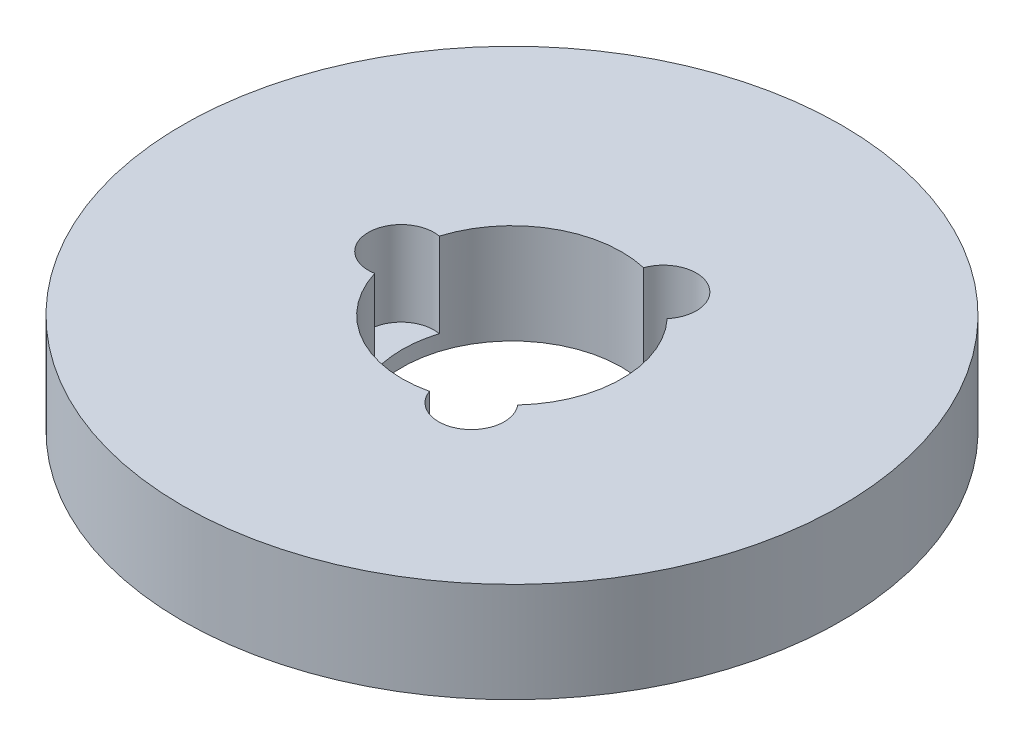
from build123d import *

# Parameters (mm, degrees)
SKETCH1_R           = 82.5
BOSS_EXTRUDE1_DEPTH = 25
SKETCH2_R           = 27.5
CUT_EXTRUDE1_DEPTH  = 120.320995638
SKETCH3_R           = 8.21948386
CUT_EXTRUDE2_DEPTH  = 21.153769994
CIRPATTERN1_COUNT   = 3


with BuildPart() as part:
    # Sketch1 → Boss-Extrude1 (new body)
    with BuildSketch(Plane(origin=(0, 0, 0), x_dir=(1, 0, 0), z_dir=(0, 1, 0))):
        Circle(SKETCH1_R)
    extrude(amount=BOSS_EXTRUDE1_DEPTH)

    # Sketch2 → Cut-Extrude1 (cut, through all)
    with BuildSketch(Plane(origin=(0, 0, 0), x_dir=(1, 0, 0), z_dir=(0, 1, 0))):
        Circle(SKETCH2_R)
    extrude(amount=CUT_EXTRUDE1_DEPTH, mode=Mode.SUBTRACT)

    # Sketch3 → Cut-Extrude2 (cut)
    with BuildSketch(Plane(origin=(0, 25, 0), x_dir=(1, 0, 0), z_dir=(0, 1, 0))):
        with Locations((-27.753009587, 0)):
            Circle(SKETCH3_R)
    cut_extrude2 = extrude(amount=-CUT_EXTRUDE2_DEPTH, mode=Mode.SUBTRACT)

    # CirPattern1: Cut-Extrude2 ×3 about axis
    cirpattern1_axis = Axis((0, 0, 0), (0, 1, 0))
    for i in range(1, CIRPATTERN1_COUNT):
        add(cut_extrude2.rotate(cirpattern1_axis, i * 360 / CIRPATTERN1_COUNT), mode=Mode.SUBTRACT)


solid = part.part
